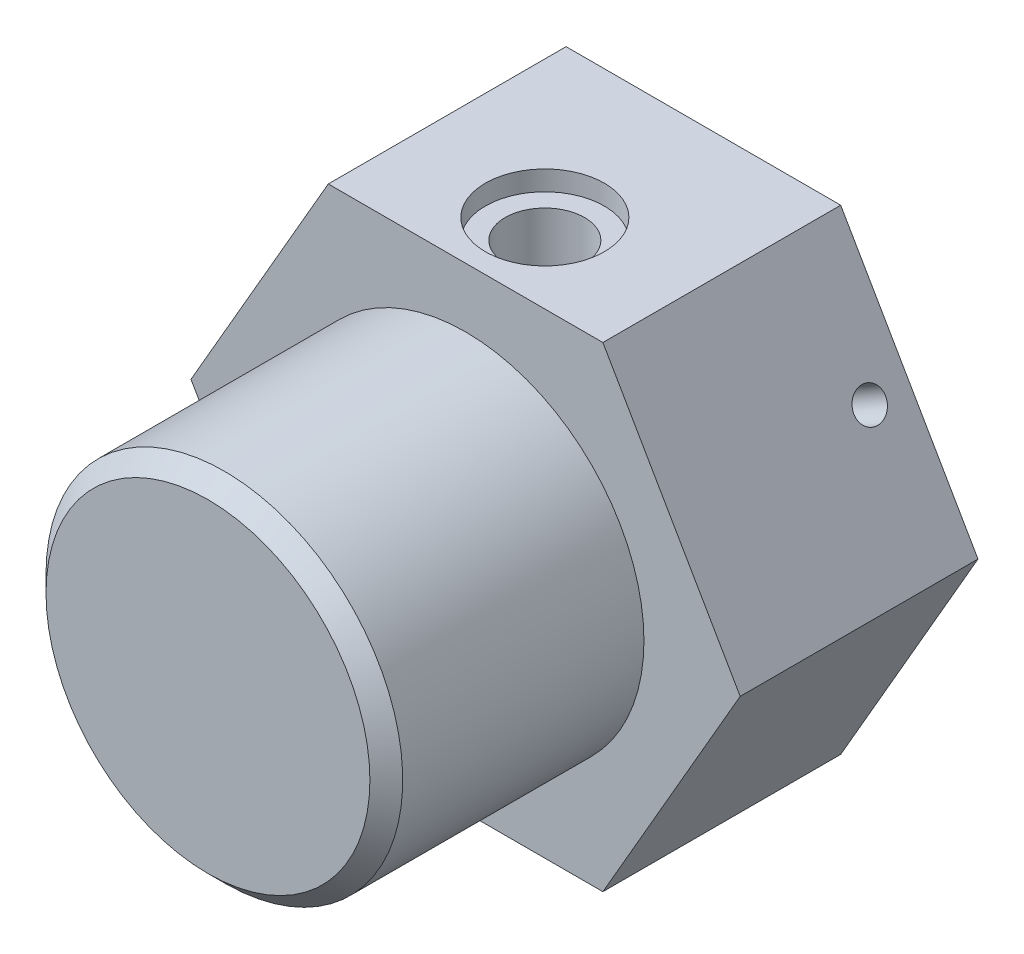
from build123d import *

# Parameters (mm, degrees)
BOSS_EXTRUDE1_DEPTH        = 12
SKETCH2_R                  = 10
BOSS_EXTRUDE2_DEPTH        = 13
F_12_0MM_DOWEL_HOLE1_D     = 12
F_12_0MM_DOWEL_HOLE1_DEPTH = 15
F_12_0MM_DOWEL_HOLE1_TIP   = 3.605163714
F_4_0MM_DOWEL_HOLE1_D      = 4
M2X0_4_TAPPED_HOLE1_REACH  = 41.205
M2X0_4_TAPPED_HOLE1_BORE_R = 0.8
SKETCH11_R                 = 3
CUT_EXTRUDE1_DEPTH         = 1
CIRPATTERN1_COUNT          = 2
CUT_EXTRUDE2_START         = -3
SKETCH13_R                 = 10.893382682
SKETCH13_R_2               = 9
CUT_EXTRUDE2_DEPTH         = 3


# Read off the part's stored shape, not the designer's step: M18x1.5 Machine Threads Stud1
with BuildPart() as part:
    # Sketch1 → Boss-Extrude1 (new body)
    with BuildSketch(Plane.XY):
        Polygon((6.92820323, 12), (-6.92820323, 12), (-13.856406461, 0), (-6.92820323, -12), (6.92820323, -12), (13.856406461, 0), align=None)
    extrude(amount=BOSS_EXTRUDE1_DEPTH)

    # Sketch2 → Boss-Extrude2 (add)
    with BuildSketch(Plane.XY.offset(12)):
        with Locations(Location((0, 0, 0), (0, 0, 180))):
            Circle(SKETCH2_R)
    extrude(amount=BOSS_EXTRUDE2_DEPTH)

    # Ø12.0mm Dowel Hole1
    with Locations(Plane(origin=(0, 0, 0), x_dir=(-1, 0, 0), z_dir=(0, 0, -1))):
        with Locations((0, 0)):
            Hole(F_12_0MM_DOWEL_HOLE1_D / 2, depth=F_12_0MM_DOWEL_HOLE1_DEPTH)
            with Locations((0, 0, -(F_12_0MM_DOWEL_HOLE1_DEPTH + F_12_0MM_DOWEL_HOLE1_TIP / 2))):  # 118° drill point
                Cone(0, F_12_0MM_DOWEL_HOLE1_D / 2, F_12_0MM_DOWEL_HOLE1_TIP, mode=Mode.SUBTRACT)

    # Ø4.0mm Dowel Hole1 (through all)
    with Locations(Plane(origin=(0, 12, 0), x_dir=(1, 0, 0), z_dir=(0, 1, 0))):
        with Locations((0, -8)):
            Hole(F_4_0MM_DOWEL_HOLE1_D / 2)

    # M2x0.4 Tapped Hole1 bore → M2x0.4 Tapped Hole1 (cut, up to next)
    with BuildSketch(Plane(origin=(10.392304845, 6, 0), x_dir=(0, 0, -1), z_dir=(0.8660254037844387, 0.49999999999999994, 0)), mode=Mode.PRIVATE) as m2x0_4_tapped_hole1_sk1:
        with Locations((-2, 0)):
            Circle(M2X0_4_TAPPED_HOLE1_BORE_R)
    m2x0_4_tapped_hole1_tool1 = extrude(m2x0_4_tapped_hole1_sk1.sketch, amount=-M2X0_4_TAPPED_HOLE1_REACH, mode=Mode.PRIVATE) & part.part
    add(m2x0_4_tapped_hole1_tool1.solids().sort_by_distance((10.392305, 6, 2))[0], mode=Mode.SUBTRACT)

    # Sketch11 → Cut-Extrude1 (cut)
    with BuildSketch(Plane.XZ.offset(12)):
        with Locations((0, 8)):
            Circle(SKETCH11_R)
    cut_extrude1 = extrude(amount=-CUT_EXTRUDE1_DEPTH, mode=Mode.SUBTRACT)

    # CirPattern1: Cut-Extrude1 ×2 about axis
    cirpattern1_axis = Axis((0, 0, 25), (0, 0, -1))
    for i in range(1, CIRPATTERN1_COUNT):
        add(cut_extrude1.rotate(cirpattern1_axis, i * 360 / CIRPATTERN1_COUNT), mode=Mode.SUBTRACT)

    # M18x1.5 Machine Threads Stud1 outline → M18x1.5 Machine Threads Stud1 (revolve, cut)
    with BuildSketch(Plane.XZ):
        Polygon((10, 25), (8.172, 25), (9, 24.172), (9, 15), (10, 15), align=None)
    revolve(axis=Axis((0, 0, 0), (0, 0, 1)), mode=Mode.SUBTRACT)

    # Sketch13 → Cut-Extrude2 (cut)
    with BuildSketch(Plane.XY.offset(15).offset(CUT_EXTRUDE2_START)):
        Circle(SKETCH13_R)
        with Locations(Location((0, 0, 0), (0, 0, 180))):
            Circle(SKETCH13_R_2, mode=Mode.SUBTRACT)
    extrude(amount=CUT_EXTRUDE2_DEPTH, mode=Mode.SUBTRACT)


solid = part.part
